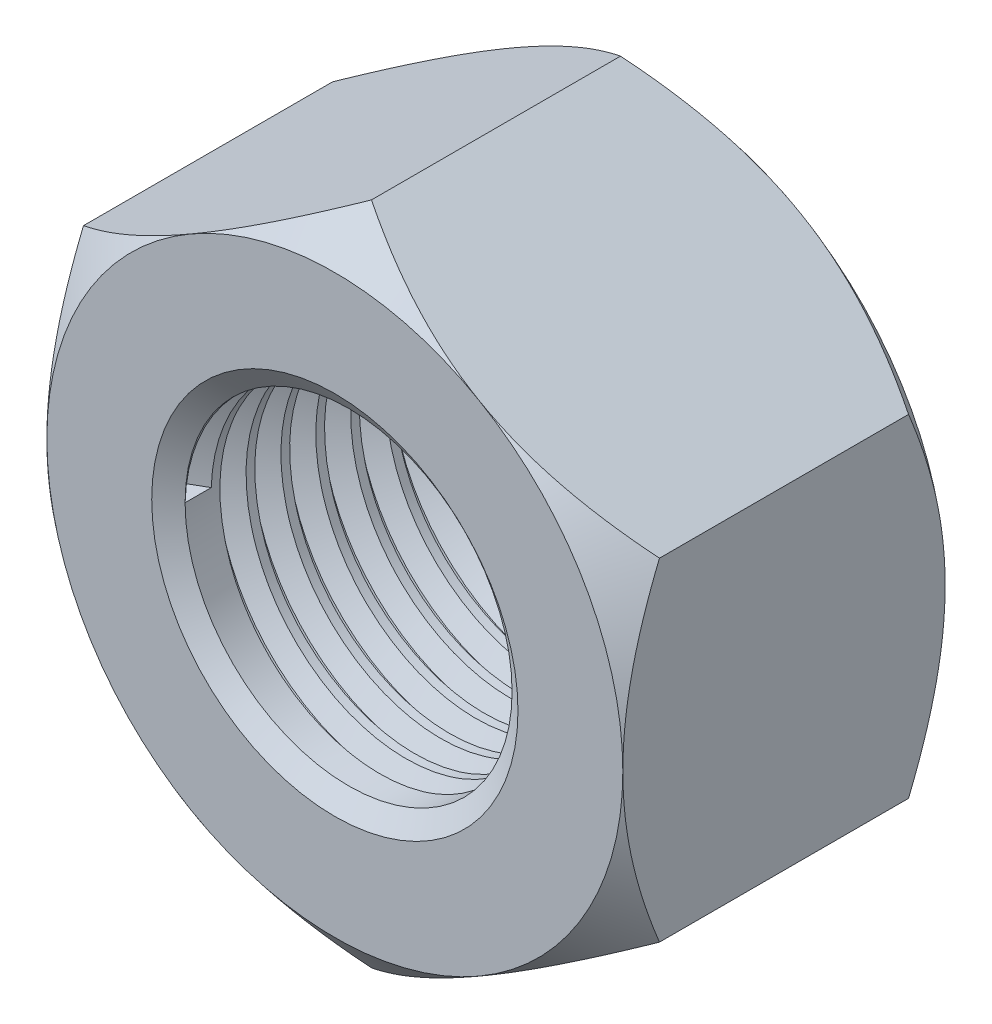
from build123d import *

# Parameters (mm, degrees)
BASENUTSKE_R  = 4.96062
BASENUT_DEPTH = 9.779
THREAD1_PITCH = 1.058333333


with BuildPart() as part:
    # BaseNutSke → BaseNut (new body)
    with BuildSketch(Plane.XY):
        Polygon((8.7376, 5.044655712), (8.7376, -5.044655712), (0, -10.089311424), (-8.7376, -5.044655712), (-8.7376, 5.044655712), (0, 10.089311424), align=None)
        Circle(BASENUTSKE_R, mode=Mode.SUBTRACT)
    extrude(amount=-BASENUT_DEPTH)

    # Sketch3 → Double-Chamfer (revolve, cut)
    with BuildSketch(Plane(origin=(0, 0, 0), x_dir=(0, 0, -1), z_dir=(1, 0, 0))):
        Polygon((9.779, 8.7376), (8.66775, 10.089311424), (8.66775, 22.789311424), (22.479, 22.789311424), (22.479, 8.7376), align=None)
        Polygon((1.11125, 22.789311424), (-12.7, 22.789311424), (-12.7, 8.7376), (0, 8.7376), (1.11125, 10.089311424), align=None)
    revolve(axis=Axis((0, 0, 0), (0, 0, -1)), mode=Mode.SUBTRACT)

    # Sketch5 → EndChamfer (revolve, cut)
    with BuildSketch(Plane(origin=(0, 0, 0), x_dir=(0, 0, -1), z_dir=(1, 0, 0)), mode=Mode.PRIVATE) as endchamfer_sk:
        Polygon((9.7536, 5.55625), (9.294828922, 4.901057), (9.8044, 4.901057), (9.8044, 5.55625), align=None)
        Polygon((-0.0508, 5.55625), (0, 5.55625), (0.458771078, 4.901057), (-0.0508, 4.901057), align=None)
    revolve(endchamfer_sk.sketch.rotate(Axis((0, 0, -25.037505729), (0, 0, -1)), 90), axis=Axis((0, 0, -25.037505729), (0, 0, -1)), mode=Mode.SUBTRACT)

    # Thread1: the profile of Thread Profile1 profile screwed along a right-hand helix of 8.427846 turns, 8 arcs to a turn; built about Z, then put on its axis
    thread1_z = Axis((0, 0, 0), (0, 0, 1))
    thread1_corners = [(4.96032, 0, -0.000173205), (5.533459718, 0, 0.330729165), (5.533459718, 0, 0.463020832), (4.96032, 0, 0.793923202)]
    with BuildLine(mode=Mode.PRIVATE) as thread1_profile:
        Line(thread1_corners[0], thread1_corners[1])
        Line(thread1_corners[1], thread1_corners[2])
        Line(thread1_corners[2], thread1_corners[3])
        Line(thread1_corners[3], thread1_corners[0])
    thread1_cap = Face(thread1_profile.wire())
    thread1_turn_angles = [0, 22.5, 45, 67.5, 90, 112.5, 135, 157.5, 180, 202.5, 225, 247.5, 270, 292.5, 315, 337.5, 360]
    thread1_turn_weights = [1, 0.9238795325112867, 1, 0.9238795325112867, 1, 0.9238795325112867, 1, 0.9238795325112867, 1, 0.9238795325112867, 1, 0.9238795325112867, 1, 0.9238795325112867, 1, 0.9238795325112867, 1]
    thread1_turn_rails = [Edge.make_bspline([Vector(p[0], p[1], 0).rotate(thread1_z, thread1_turn_angles[k]) / thread1_turn_weights[k] + Vector(0, 0, p[2] + THREAD1_PITCH * thread1_turn_angles[k] / 360) for k in range(17)], [0, 0, 0, 1, 1, 2, 2, 3, 3, 4, 4, 5, 5, 6, 6, 7, 7, 8, 8, 8], 2, thread1_turn_weights) for p in thread1_corners]
    thread1_turn_sides = [Face.make_surface_from_curves(thread1_turn_rails[p[0]], thread1_turn_rails[p[1]]) for p in [(0, 1), (1, 2), (2, 3), (3, 0)]]
    thread1_last_angles = [2880, 2902.5, 2925, 2947.5, 2970, 2992.5, 3015, 3024.512351098, 3034.024702197]
    thread1_last_weights = [1, 0.9238795325112867, 1, 0.9238795325112867, 1, 0.9238795325112867, 1, 0.986249999749232, 1]
    thread1_last_rails = [Edge.make_bspline([Vector(p[0], p[1], 0).rotate(thread1_z, thread1_last_angles[k]) / thread1_last_weights[k] + Vector(0, 0, p[2] + THREAD1_PITCH * thread1_last_angles[k] / 360) for k in range(9)], [0, 0, 0, 1, 1, 2, 2, 3, 3, 4, 4, 4], 2, thread1_last_weights) for p in thread1_corners]
    thread1_last_sides = [Face.make_surface_from_curves(thread1_last_rails[p[0]], thread1_last_rails[p[1]]) for p in [(0, 1), (1, 2), (2, 3), (3, 0)]]
    thread1 = Plane(origin=(0, 0, -0.417064616), x_dir=(-1, 0, 0), z_dir=(0, 0, -1)) * Solid(Shell([*[p.moved(Location((0, 0, THREAD1_PITCH * i))) for i in range(8) for p in thread1_turn_sides], *thread1_last_sides, thread1_cap, thread1_cap.rotate(thread1_z, 3034.024702197).moved(Location((0, 0, THREAD1_PITCH * 3034.024702197 / 360)))]))
    add(thread1, mode=Mode.SUBTRACT)


solid = part.part
